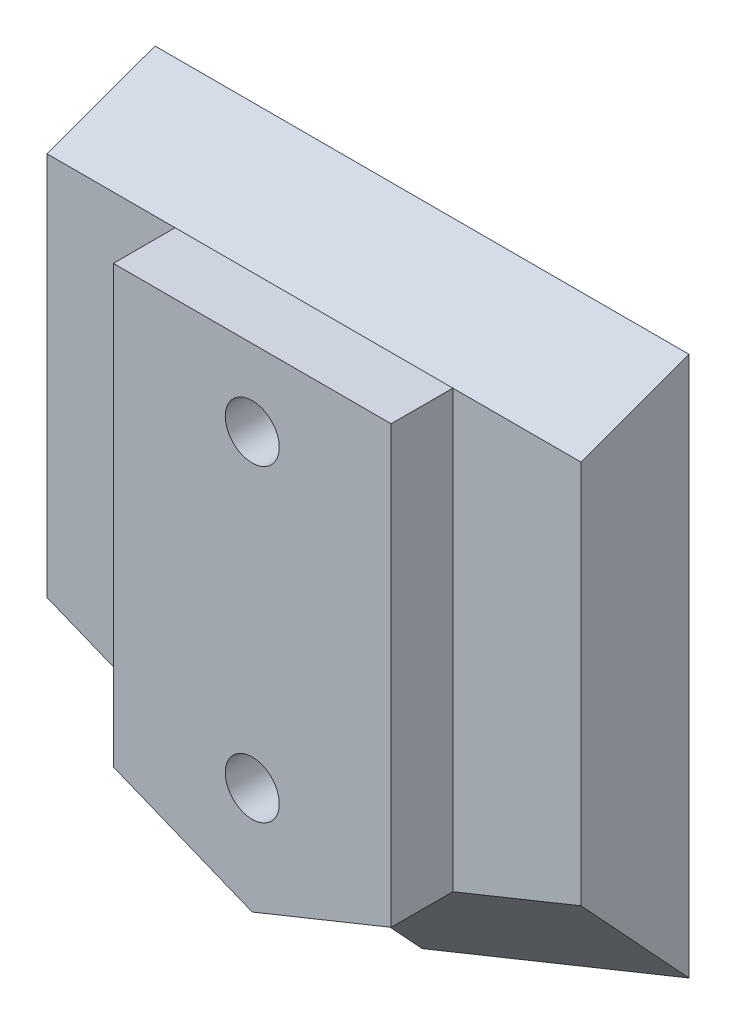
from build123d import *

# Parameters (mm, degrees)
ESBO_O1_W                = 34.6
ESBO_O1_H                = 26
RESSALTO_EXTRUS_O1_DEPTH = 7
ESBO_O10_W               = 34.6
ESBO_O10_H               = 2.5
RESSALTO_EXTRUS_O4_DEPTH = 7
CHANFRO1_SIZE            = 7
CHANFRO2_SIZE2           = 7
CHANFRO2_SIZE            = 2.54779164
RESSALTO_EXTRUS_O5_DEPTH = 4
ESBO_O11_R               = 1.75
CORTE_EXTRUS_O1_DEPTH    = 34.504328079
ESBO_O12_R               = 3.5
CORTE_EXTRUS_O2_DEPTH    = 3


with BuildPart() as part:
    # Esboço1 → Ressalto-extrusão1 (new body)
    with BuildSketch(Plane.XY):
        Rectangle(ESBO_O1_W, ESBO_O1_H)
    extrude(amount=RESSALTO_EXTRUS_O1_DEPTH)

    # Esboço10 → Ressalto-extrusão4 (add)
    with BuildSketch(Plane(origin=(0, 0, 0), x_dir=(-1, 0, 0), z_dir=(0, 0, -1))):
        Polygon((-17.3, -19.5), (0, -26.5), (17.3, -19.5), (17.3, -13), (-17.3, -13), align=None)
        with Locations((0, 14.25)):
            Rectangle(ESBO_O10_W, ESBO_O10_H)
    extrude(amount=-RESSALTO_EXTRUS_O4_DEPTH)

    # Chanfro1
    chanfro1_edges = [part.edges().sort_by_distance(p)[0] for p in [
        (8.65, -23, 7),
        (-8.65, -23, 7),
    ]]
    chamfer(chanfro1_edges, length=CHANFRO1_SIZE - 0.0001)  # a hair under: the kernel refuses the full size

    # Chanfro2
    chanfro2_edges = [part.edges().sort_by_distance(p)[0] for p in [
        (0, 15.5, 7),
    ]]
    chanfro2_side = [part.faces().sort_by_distance(p)[0] for p in [
        (0, 15.449044167, 7),
    ]]
    chamfer(chanfro2_edges, length=CHANFRO2_SIZE - 0.0001, length2=CHANFRO2_SIZE2 - 0.0001, reference=chanfro2_side[0])  # a hair under: the kernel refuses the full size

    # Esboço13 → Ressalto-extrusão5 (add)
    with BuildSketch(Plane.XY.offset(7)):
        Polygon((9, -15.307069068), (9, 12.95220836), (-9, 12.95220836), (-9, -15.307069068), (0, -18.948687565), align=None)
    extrude(amount=RESSALTO_EXTRUS_O5_DEPTH)

    # Esboço11 → Corte-extrusão1 (cut, through all)
    with BuildSketch(Plane.XY.offset(11)):
        with Locations(Location((0, -12, 0), (0, 0, 180))):
            Circle(ESBO_O11_R)
        with Locations(Location((0, 8, 0), (0, 0, 180))):
            Circle(ESBO_O11_R)
    extrude(amount=-CORTE_EXTRUS_O1_DEPTH, mode=Mode.SUBTRACT)

    # Esboço12 → Corte-extrusão2 (cut)
    with BuildSketch(Plane(origin=(0, 0, 0), x_dir=(-1, 0, 0), z_dir=(0, 0, -1))):
        with Locations((0, 8)):
            Circle(ESBO_O12_R)
        with Locations((0, -12)):
            Circle(ESBO_O12_R)
    extrude(amount=-CORTE_EXTRUS_O2_DEPTH, mode=Mode.SUBTRACT)


solid = part.part
